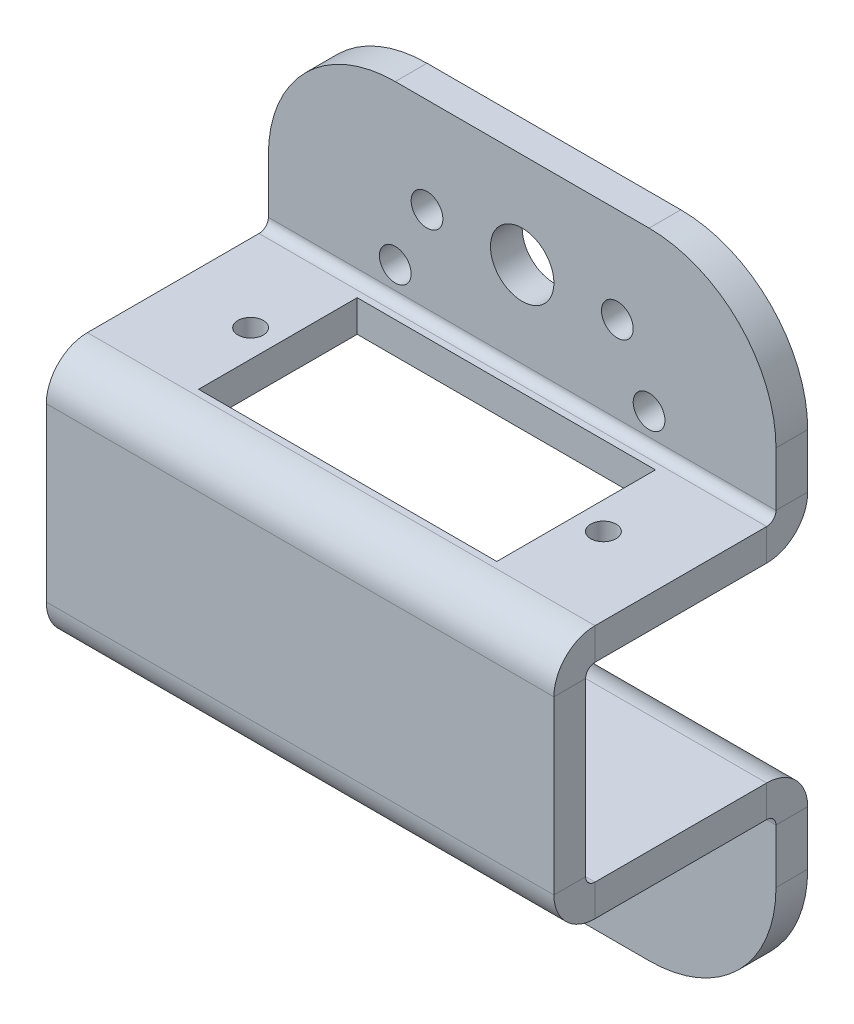
from build123d import *

# Parameters (mm, degrees)
SKETCH1_W           = 40
SKETCH1_H           = 50
SKETCH1_R           = 1.25
BASE_FLANGE1_DEPTH  = 2.5
SKETCH15_R          = 1
CUT_EXTRUDE3_DEPTH  = 10
JOG3_START          = -2.5
JOG3_OUTLINE_W      = 40
JOG3_OUTLINE_H      = 48.294687966
JOG3_OUTLINE_R      = 1
JOG3_OUTLINE_R_2    = 1.25
JOG3_DEPTH          = 2.5
JOG3_2_OUTLINE_W    = 40
JOG3_2_OUTLINE_H    = 1.705312034
JOG3_2_DEPTH        = 0.332528284
JOG3_START_2        = 14.2634
JOG3_3_OUTLINE_W    = 40
JOG3_3_OUTLINE_H    = 35
JOG3_3_OUTLINE_R    = 1
JOG3_3_OUTLINE_R_2  = 1.25
JOG3_3_DEPTH        = 3.2366
JOG3_4_OUTLINE_W    = 40
JOG3_4_OUTLINE_H    = 15.794687966
JOG3_4_OUTLINE_R    = 1.25
JOG3_4_DEPTH        = 3.2366
JOG3_5_OUTLINE_W    = 40
JOG3_5_OUTLINE_H    = 2.5
JOG3_5_DEPTH        = 15
JOG3_START_3        = 15
JOG3_6_OUTLINE_R    = 1.25
JOG3_6_OUTLINE_R_2  = 1
JOG3_6_DEPTH        = 2.5
JOG3_START_4        = -20
JOG3_7_DEPTH        = 40
JOG4_START          = -20
JOG4_DEPTH          = 40
JOG4_2_DEPTH        = 40
JOG4_START_2        = -3
JOG4_3_OUTLINE_R    = 1.25
JOG4_3_DEPTH        = 4
FILLET1_R           = 10
SKETCH18_R          = 2.5
BOSS_EXTRUDE1_DEPTH = 2.5
SKETCH19_R          = 1
SKETCH19_W          = 23.5
SKETCH19_H          = 12.5
CUT_EXTRUDE4_DEPTH  = 2.5
SKETCH20_R          = 2.5
SKETCH20_R_2        = 1.25
CUT_EXTRUDE6_DEPTH  = 10
SKETCH23_R          = 2.5
CUT_EXTRUDE7_DEPTH  = 44.945989578
SKETCH24_R          = 5
CUT_EXTRUDE8_DEPTH  = 1.25


with BuildPart() as part:
    # Base-Flange1: sheet metal written as solids
    # Sketch1 → Base-Flange1 (new body)
    with BuildSketch(Plane.XY):
        Rectangle(SKETCH1_W, SKETCH1_H)
        with Locations((10, 12.5)):
            Circle(SKETCH1_R, mode=Mode.SUBTRACT)
        with Locations(Location((10, -12.5, 0), (0, 0, 180))):
            Circle(SKETCH1_R, mode=Mode.SUBTRACT)
        with Locations((-10, -12.5)):
            Circle(SKETCH1_R, mode=Mode.SUBTRACT)
        with Locations(Location((-10, 12.5, 0), (0, 0, 180))):
            Circle(SKETCH1_R, mode=Mode.SUBTRACT)
    extrude(amount=-BASE_FLANGE1_DEPTH)

    # Sketch15 → Cut-Extrude3 (cut)
    with BuildSketch(Plane.XY):
        with Locations((12, 0)):
            Circle(SKETCH15_R)
        with Locations(Location((-17, 0, 0), (0, 0, 180))):
            Circle(SKETCH15_R)
    extrude(amount=-CUT_EXTRUDE3_DEPTH, mode=Mode.SUBTRACT)

    # Jog3: read off the stored shape, not the designer's step
    # Jog3 outline → Jog3 (cut)
    with BuildSketch(Plane.XY.offset(JOG3_START)):
        with Locations((0, -0.852656017)):
            Rectangle(JOG3_OUTLINE_W, JOG3_OUTLINE_H)
        with Locations((-17, 0)):
            Circle(JOG3_OUTLINE_R, mode=Mode.SUBTRACT)
        with Locations((12, 0)):
            Circle(JOG3_OUTLINE_R, mode=Mode.SUBTRACT)
        with Locations((-10, 12.5)):
            Circle(JOG3_OUTLINE_R_2, mode=Mode.SUBTRACT)
        with Locations((10, 12.5)):
            Circle(JOG3_OUTLINE_R_2, mode=Mode.SUBTRACT)
        with Locations((10, -12.5)):
            Circle(JOG3_OUTLINE_R_2, mode=Mode.SUBTRACT)
        with Locations((-10, -12.5)):
            Circle(JOG3_OUTLINE_R_2, mode=Mode.SUBTRACT)
    extrude(amount=JOG3_DEPTH, mode=Mode.SUBTRACT)

    # Jog3 2 outline → Jog3 2 (cut)
    with BuildSketch(Plane.XY.offset(JOG3_START)):
        with Locations((0, 24.147343983)):
            Rectangle(JOG3_2_OUTLINE_W, JOG3_2_OUTLINE_H)
    extrude(amount=JOG3_2_DEPTH, mode=Mode.SUBTRACT)

    # Jog3 4 outline → Jog3 4 (add)
    with BuildSketch(Plane.XY.offset(JOG3_START)):
        with Locations((0, 32.897343983)):
            Rectangle(JOG3_4_OUTLINE_W, JOG3_4_OUTLINE_H)
        with Locations((10, 28.294687966)):
            Circle(JOG3_4_OUTLINE_R, mode=Mode.SUBTRACT)
        with Locations((-10, 28.294687966)):
            Circle(JOG3_4_OUTLINE_R, mode=Mode.SUBTRACT)
    extrude(amount=JOG3_4_DEPTH)



with BuildPart() as body_2:
    # Jog3 3 outline → Jog3 3 (new body)
    with BuildSketch(Plane.XY.offset(JOG3_START_2)):
        with Locations((0, 8.294687966)):
            Rectangle(JOG3_3_OUTLINE_W, JOG3_3_OUTLINE_H)
        with Locations((12, 15.794687966)):
            Circle(JOG3_3_OUTLINE_R, mode=Mode.SUBTRACT)
        with Locations((-17, 0)):
            Circle(JOG3_3_OUTLINE_R, mode=Mode.SUBTRACT)
        with Locations((-10, 3.294687966)):
            Circle(JOG3_3_OUTLINE_R_2, mode=Mode.SUBTRACT)
        with Locations((12, 0)):
            Circle(JOG3_3_OUTLINE_R, mode=Mode.SUBTRACT)
        with Locations((10, 3.294687966)):
            Circle(JOG3_3_OUTLINE_R_2, mode=Mode.SUBTRACT)
        with Locations((-17, 15.794687966)):
            Circle(JOG3_3_OUTLINE_R, mode=Mode.SUBTRACT)
        with Locations((-10, 12.5)):
            Circle(JOG3_3_OUTLINE_R_2, mode=Mode.SUBTRACT)
        with Locations((10, 12.5)):
            Circle(JOG3_3_OUTLINE_R_2, mode=Mode.SUBTRACT)
    extrude(amount=JOG3_3_DEPTH)


with BuildPart() as part_1:
    add(part.part)

    add(body_2.part)  # Jog3 5 merges body 2
    # Jog3 5 outline → Jog3 5 (add)
    with BuildSketch(Plane.XY):
        with Locations((0, 24.544687966)):
            Rectangle(JOG3_5_OUTLINE_W, JOG3_5_OUTLINE_H)
    extrude(amount=JOG3_5_DEPTH)

    # Jog3 6 outline → Jog3 6 (add)
    with BuildSketch(Plane.XY.offset(JOG3_START_3)):
        with Locations((10, 12.5)):
            Circle(JOG3_6_OUTLINE_R)
        with Locations((-10, 12.5)):
            Circle(JOG3_6_OUTLINE_R)
        with Locations((12, 0)):
            Circle(JOG3_6_OUTLINE_R_2)
        with Locations((-17, 0)):
            Circle(JOG3_6_OUTLINE_R_2)
    extrude(amount=JOG3_6_DEPTH)

    # Jog3 7 outline → Jog3 7 (cut)
    with BuildSketch(Plane.YZ.offset(JOG3_START_4)):
        with BuildLine():
            ThreePointArc((23.294687966, 14.2634), (23.078942821, 14.784254855), (22.558087966, 15))
            Line((22.558087966, 15), (-9.205312034, 15))
            Line((-9.205312034, 15), (-9.205312034, 14.2634))
            Line((-9.205312034, 14.2634), (23.294687966, 14.2634))
        make_face()
        with BuildLine():
            ThreePointArc((26.531287966, -2.5), (24.242666158, -1.552021808), (23.294687966, 0.7366))
            Line((23.294687966, 0.7366), (23.294687966, -2.167471716))
            Line((23.294687966, -2.167471716), (25, -2.167471716))
            Line((25, -2.167471716), (25, -2.5))
            Line((25, -2.5), (26.531287966, -2.5))
        make_face()
        with BuildLine():
            Line((26.531287966, 0), (40.794687966, 0))
            Line((40.794687966, 0), (40.794687966, 0.7366))
            Line((40.794687966, 0.7366), (25.794687966, 0.7366))
            ThreePointArc((25.794687966, 0.7366), (26.010433111, 0.215745145), (26.531287966, 0))
        make_face()
        with BuildLine():
            Line((25.794687966, 17.5), (22.558087966, 17.5))
            ThreePointArc((22.558087966, 17.5), (24.846709774, 16.552021808), (25.794687966, 14.2634))
            Line((25.794687966, 14.2634), (25.794687966, 17.5))
        make_face()
    extrude(amount=JOG3_7_DEPTH, mode=Mode.SUBTRACT)

    # Jog4: read off the stored shape, not the designer's step
    # Jog4 outline → Jog4 (cut)
    with BuildSketch(Plane.YZ.offset(JOG4_START)):
        with BuildLine():
            Line((-9.205312034, 15), (5.87962174, 15))
            ThreePointArc((5.87962174, 15), (7.019882984, 16.799110859), (9.031287966, 17.5))
            Line((9.031287966, 17.5), (-9.205312034, 17.5))
            Line((-9.205312034, 17.5), (-9.205312034, 15))
        make_face()
    extrude(amount=JOG4_DEPTH, mode=Mode.SUBTRACT)

    # Jog4 2 outline → Jog4 2 (add)
    with BuildSketch(Plane.YZ.offset(JOG4_START)):
        with BuildLine():
            Line((-9.205312034, 0), (-9.205312034, -2.5))
            Line((-9.205312034, -2.5), (5.058087966, -2.5))
            ThreePointArc((5.058087966, -2.5), (7.346709774, -1.552021808), (8.294687966, 0.7366))
            Line((8.294687966, 0.7366), (8.294687966, 14.2634))
            ThreePointArc((8.294687966, 14.2634), (8.510433111, 14.784254855), (9.031287966, 15))
            Line((9.031287966, 15), (5.87962174, 15))
            ThreePointArc((5.87962174, 15), (5.81599152, 14.634140241), (5.794687966, 14.2634))
            Line((5.794687966, 14.2634), (5.794687966, 0.7366))
            ThreePointArc((5.794687966, 0.7366), (5.578942821, 0.215745145), (5.058087966, 0))
            Line((5.058087966, 0), (-9.205312034, 0))
        make_face()
    extrude(amount=JOG4_2_DEPTH)

    # Jog4 3 outline → Jog4 3 (cut)
    with BuildSketch(Plane.XY.offset(JOG4_START_2)):
        with Locations((-10, 3.294687966)):
            Circle(JOG4_3_OUTLINE_R)
        with Locations((10, 3.294687966)):
            Circle(JOG4_3_OUTLINE_R)
    extrude(amount=JOG4_3_DEPTH, mode=Mode.SUBTRACT)

    # Fillet1
    fillet1_edges = [part_1.edges().sort_by_distance(p)[0] for p in [
        (20, -9.205312034, -1.25),
        (-20, -9.205312034, -1.25),
        (-20, 40.794687966, -1.25),
        (20, 40.794687966, -1.25),
    ]]
    fillet(fillet1_edges, radius=FILLET1_R)

    # Sketch18 → Boss-Extrude1 (add)
    with BuildSketch(Plane.XY.offset(17.5)):
        with Locations((12, 15.794687966)):
            Circle(SKETCH18_R)
        with Locations((-17, 15.794687966)):
            Circle(SKETCH18_R)
    extrude(amount=-BOSS_EXTRUDE1_DEPTH)

    # Sketch19 → Cut-Extrude4 (cut)
    with BuildSketch(Plane(origin=(0, 25.794687966, 0), x_dir=(1, 0, 0), z_dir=(0, 1, 0))):
        with Locations(Location((13.9, -7.5, 0), (0, 0, 270))):
            Circle(SKETCH19_R)
        with Locations(Location((-13.9, -7.5, 0), (0, 0, 90))):
            Circle(SKETCH19_R)
        with Locations((0, -7.5)):
            Rectangle(SKETCH19_W, SKETCH19_H)
    extrude(amount=-CUT_EXTRUDE4_DEPTH, mode=Mode.SUBTRACT)

    # Sketch20 → Cut-Extrude6 (cut)
    with BuildSketch(Plane.XY):
        with Locations((0, 33.294687966)):
            Circle(SKETCH20_R)
        with Locations(Location((0, -1.705312034, 0), (0, 0, 180))):
            Circle(SKETCH20_R)
        with Locations((7.5, -1.705312034)):
            Circle(SKETCH20_R_2)
        with Locations(Location((-7.5, -1.705312034, 0), (0, 0, 180))):
            Circle(SKETCH20_R_2)
        with Locations(Location((7.5, 33.294687966, 0), (0, 0, 180))):
            Circle(SKETCH20_R_2)
        with Locations((-7.5, 33.294687966)):
            Circle(SKETCH20_R_2)
    extrude(amount=-CUT_EXTRUDE6_DEPTH, mode=Mode.SUBTRACT)

    # Sketch23 → Cut-Extrude7 (cut, through all)
    with BuildSketch(Plane(origin=(0, 25.794687966, 0), x_dir=(1, 0, 0), z_dir=(0, 1, 0))):
        with Locations(Location((-5.55, -7.5, 0), (0, 0, 270))):
            Circle(SKETCH23_R)
    extrude(amount=-CUT_EXTRUDE7_DEPTH, mode=Mode.SUBTRACT)

    # Sketch24 → Cut-Extrude8 (cut)
    with BuildSketch(Plane(origin=(0, 8.294687966, 0), x_dir=(1, 0, 0), z_dir=(0, 1, 0))):
        with Locations(Location((-5.55, -7.5, 0), (0, 0, 270))):
            Circle(SKETCH24_R)
    extrude(amount=-CUT_EXTRUDE8_DEPTH, mode=Mode.SUBTRACT)


solid = part_1.part
